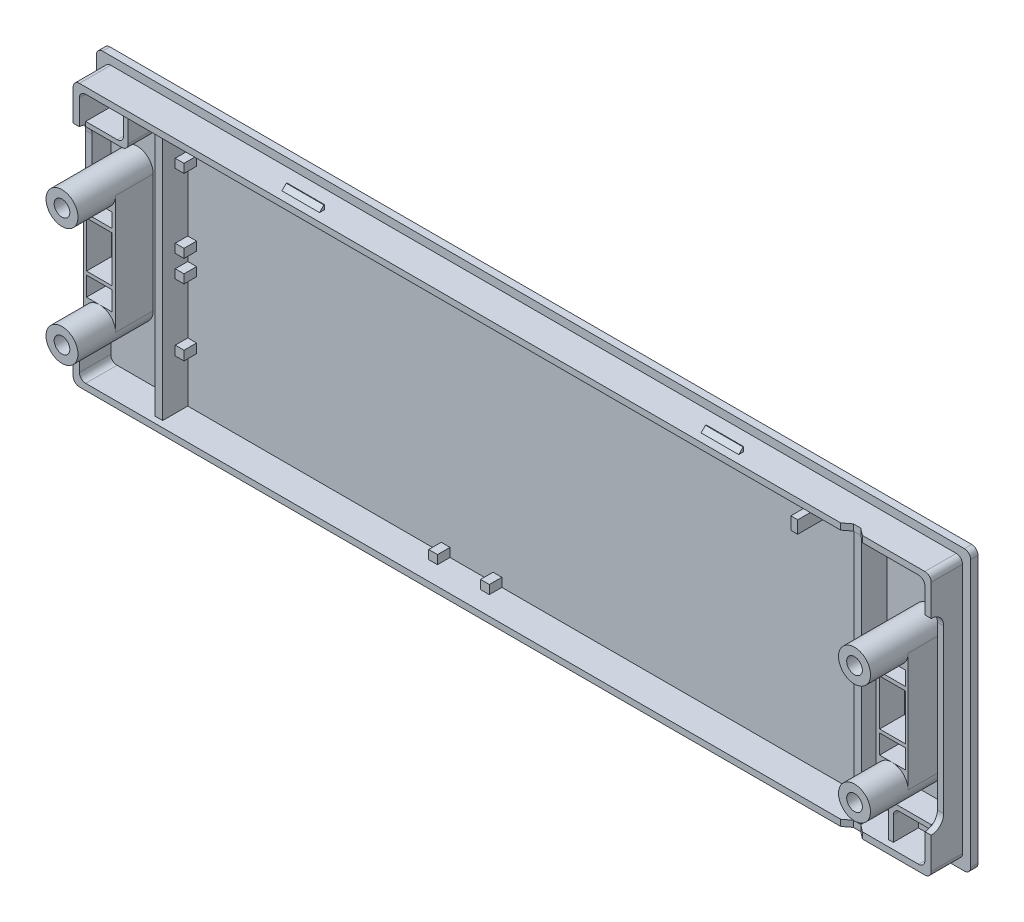
from build123d import *

# Parameters (mm, degrees)
SKETCH1_W                = 139.43
SKETCH1_H                = 44.53
BOSS_EXTRUDE1_DEPTH      = 1.17
SKETCH2_W                = 136.83
SKETCH2_H                = 41.93
SKETCH2_W_2              = 134.83
SKETCH2_H_2              = 39.93
BOSS_EXTRUDE2_DEPTH      = 5
SKETCH3_W                = 1.2
SKETCH3_H                = 39.93
BOSS_EXTRUDE3_DEPTH      = 4
SKETCH4_W                = 7.69
SKETCH4_H                = 39.93
BOSS_EXTRUDE4_DEPTH      = 11
CUT_EXTRUDE1_REACH       = 148.873
SKETCH5_W                = 7.69
SKETCH5_H                = 6.9
SKETCH6_R                = 2.55
BOSS_EXTRUDE6_DEPTH      = 2
CUT_EXTRUDE3_START       = -11
SKETCH7_W                = 7.69
SKETCH7_H                = 26.13
CUT_EXTRUDE3_DEPTH       = 11
SKETCH8_R                = 2.55
BOSS_EXTRUDE7_DEPTH      = 13
CUT_EXTRUDE4_DEPTH       = 5
SKETCH10_R               = 2.55
CUT_EXTRUDE5_DEPTH       = 1
SKETCH11_W               = 4.087353889
SKETCH11_H               = 7.313157693
CUT_EXTRUDE6_DEPTH       = 4
SKETCH12_W               = 4.087353889
SKETCH12_H               = 3.058395844
CUT_EXTRUDE7_DEPTH       = 4
SKETCH13_R               = 1.25
CUT_EXTRUDE8_DEPTH       = 10
SKETCH14_W               = 69.715
SKETCH14_H               = 44.53
CUT_EXTRUDE9_DEPTH       = 147.873260671
FILLET1_R                = 1
FILLET2_R                = 1
BOSS_EXTRUDE8_DEPTH      = 4
FILLET3_R                = 1
SKETCH16_R               = 0.868080885
CUT_EXTRUDE10_DEPTH      = 147.859272094
SKETCH17_W               = 1.4
SKETCH17_H               = 1.4
SKETCH17_H_2             = 1.487239033
BOSS_EXTRUDE10_DEPTH     = 2
SKETCH18_W               = 1.1
SKETCH18_H               = 2
BOSS_EXTRUDE11_DEPTH     = 7
CUT_EXTRUDE11_DEPTH      = 147.279002936
CUT_EXTRUDE11_DEPTH_BACK = 147.279002936
SKETCH20_W               = 6
SKETCH20_H               = 1.407940832
BOSS_EXTRUDE12_DEPTH     = 0.7
CHAMFER1_SIZE            = 1
SKETCH21_W               = 6
SKETCH21_H               = 1.1
BOSS_EXTRUDE13_DEPTH     = 0.7
CHAMFER2_SIZE            = 1
CUT_EXTRUDE12_START      = -1
SKETCH22_W               = 2
SKETCH22_H               = 29.93
CUT_EXTRUDE12_DEPTH      = 1
SKETCH23_W               = 2
SKETCH23_H               = 29.93
CUT_EXTRUDE13_DEPTH      = 1
FILLET4_R                = 2


with BuildPart() as part:
    # Sketch1 → Boss-Extrude1 (new body)
    with BuildSketch(Plane.XY):
        with Locations((69.715, 22.265)):
            Rectangle(SKETCH1_W, SKETCH1_H)
    extrude(amount=BOSS_EXTRUDE1_DEPTH)

    # Sketch2 → Boss-Extrude2 (add)
    with BuildSketch(Plane.XY.offset(1.17)):
        with Locations((69.715, 22.265)):
            Rectangle(SKETCH2_W, SKETCH2_H)
        with Locations((69.715, 22.265)):
            Rectangle(SKETCH2_W_2, SKETCH2_H_2, mode=Mode.SUBTRACT)
    extrude(amount=BOSS_EXTRUDE2_DEPTH)

    # Sketch3 → Boss-Extrude3 (add)
    with BuildSketch(Plane.XY.offset(1.17)):
        with Locations((13.98, 22.265)):
            Rectangle(SKETCH3_W, SKETCH3_H)
        with Locations((125.45, 22.265)):
            Rectangle(SKETCH3_W, SKETCH3_H)
    extrude(amount=BOSS_EXTRUDE3_DEPTH)

    # Sketch4 → Boss-Extrude4 (add)
    with BuildSketch(Plane.XY.offset(1.17)):
        with Locations((133.285, 22.265)):
            Rectangle(SKETCH4_W, SKETCH4_H)
        with Locations((6.145, 22.265)):
            Rectangle(SKETCH4_W, SKETCH4_H)
    extrude(amount=BOSS_EXTRUDE4_DEPTH)

    # Cut-Extrude1: up to this face of the body (flat: up to its plane)
    cut_extrude1_end = Plane(part.part.faces().sort_by_distance((127.745, 22.265, 1.17))[0])
    # Sketch5 → Cut-Extrude1 (cut, up to the picked face)
    with BuildSketch(Plane.XY.offset(12.17), mode=Mode.PRIVATE) as cut_extrude1_sk1:
        with Locations((133.285, 5.75)):
            Rectangle(SKETCH5_W, SKETCH5_H)
    cut_extrude1_tool1 = split(extrude(cut_extrude1_sk1.sketch, amount=-CUT_EXTRUDE1_REACH, mode=Mode.PRIVATE), bisect_by=cut_extrude1_end, keep=Keep.BOTH, mode=Mode.PRIVATE)
    # Sketch5 → Cut-Extrude1 (cut, up to the picked face)
    with BuildSketch(Plane.XY.offset(12.17), mode=Mode.PRIVATE) as cut_extrude1_sk2:
        with Locations((133.285, 38.78)):
            Rectangle(SKETCH5_W, SKETCH5_H)
    cut_extrude1_tool2 = split(extrude(cut_extrude1_sk2.sketch, amount=-CUT_EXTRUDE1_REACH, mode=Mode.PRIVATE), bisect_by=cut_extrude1_end, keep=Keep.BOTH, mode=Mode.PRIVATE)
    # Sketch5 → Cut-Extrude1 (cut, up to the picked face)
    with BuildSketch(Plane.XY.offset(12.17), mode=Mode.PRIVATE) as cut_extrude1_sk3:
        with Locations((6.145, 38.78)):
            Rectangle(SKETCH5_W, SKETCH5_H)
    cut_extrude1_tool3 = split(extrude(cut_extrude1_sk3.sketch, amount=-CUT_EXTRUDE1_REACH, mode=Mode.PRIVATE), bisect_by=cut_extrude1_end, keep=Keep.BOTH, mode=Mode.PRIVATE)
    # Sketch5 → Cut-Extrude1 (cut, up to the picked face)
    with BuildSketch(Plane.XY.offset(12.17), mode=Mode.PRIVATE) as cut_extrude1_sk4:
        with Locations((6.145, 5.75)):
            Rectangle(SKETCH5_W, SKETCH5_H)
    cut_extrude1_tool4 = split(extrude(cut_extrude1_sk4.sketch, amount=-CUT_EXTRUDE1_REACH, mode=Mode.PRIVATE), bisect_by=cut_extrude1_end, keep=Keep.BOTH, mode=Mode.PRIVATE)
    add(cut_extrude1_tool1.solids().sort_by(Axis((133.285, 5.75, 12.17), (0, 0, -1)))[0], mode=Mode.SUBTRACT)
    add(cut_extrude1_tool2.solids().sort_by(Axis((133.285, 38.78, 12.17), (0, 0, -1)))[0], mode=Mode.SUBTRACT)
    add(cut_extrude1_tool3.solids().sort_by(Axis((6.145, 38.78, 12.17), (0, 0, -1)))[0], mode=Mode.SUBTRACT)
    add(cut_extrude1_tool4.solids().sort_by(Axis((6.145, 5.75, 12.17), (0, 0, -1)))[0], mode=Mode.SUBTRACT)

    # Sketch6 → Boss-Extrude6 (add)
    with BuildSketch(Plane.XY.offset(12.17)):
        with Locations(Location((132.908867588, 12.714769601, 0), (0, 0, 180))):
            Circle(SKETCH6_R)
        with Locations(Location((132.908867588, 31.615735275, 0), (0, 0, 180))):
            Circle(SKETCH6_R)
    extrude(amount=BOSS_EXTRUDE6_DEPTH)

    # Sketch7 → Cut-Extrude3 (cut)
    with BuildSketch(Plane.XY.offset(12.17).offset(CUT_EXTRUDE3_START)):
        with Locations((133.285, 22.265)):
            Rectangle(SKETCH7_W, SKETCH7_H)
        with BuildLine():
            Line((135.458867588, 31.615735275), (135.458867588, 12.714769601))
            ThreePointArc((135.458867588, 12.714769601), (132.908867588, 15.264769601), (130.358867588, 12.714769601))
            Line((130.358867588, 12.714769601), (130.358867588, 31.615735275))
            ThreePointArc((130.358867588, 31.615735275), (132.908867588, 29.065735275), (135.458867588, 31.615735275))
        make_face(mode=Mode.SUBTRACT)
    extrude(amount=CUT_EXTRUDE3_DEPTH, mode=Mode.SUBTRACT)


with BuildPart() as cut_extrude3_piece_1:
    # of the separate pieces the step leaves, piece 1, a body of its own (cut_extrude3_pieces)
    add(part.part.solids().sort_by_distance((0, 0, 0))[0])



with BuildPart() as cut_extrude3_piece_2:
    # of the separate pieces the step leaves, piece 2, a body of its own (cut_extrude3_pieces)
    add(part.part.solids().sort_by_distance((130.358867588, 12.714769601, 14.17))[0])


with BuildPart() as cut_extrude3_piece_3:
    # of the separate pieces the step leaves, piece 3, a body of its own (cut_extrude3_pieces)
    add(part.part.solids().sort_by_distance((130.358867588, 31.615735275, 14.17))[0])


with BuildPart() as cut_extrude3_piece_1_1:
    add(cut_extrude3_piece_1.part)

    add(cut_extrude3_piece_2.part)  # Boss-Extrude7 merges Cut-Extrude3 piece 2

    add(cut_extrude3_piece_3.part)  # Boss-Extrude7 merges Cut-Extrude3 piece 3
    # Sketch8 → Boss-Extrude7 (add)
    with BuildSketch(Plane.XY.offset(14.17)):
        with Locations((132.908867588, 12.714769601)):
            Circle(SKETCH8_R)
        with Locations((132.908867588, 31.615735275)):
            Circle(SKETCH8_R)
    extrude(amount=-BOSS_EXTRUDE7_DEPTH)

    # Sketch9 → Cut-Extrude4 (cut)
    with BuildSketch(Plane.XY.offset(12.17)):
        with BuildLine():
            Line((130.358867588, 12.714769601), (130.358867588, 31.615735275))
            ThreePointArc((130.358867588, 31.615735275), (132.908867588, 29.065735275), (135.458867588, 31.615735275))
            Line((135.458867588, 31.615735275), (135.458867588, 12.714769601))
            ThreePointArc((135.458867588, 12.714769601), (132.908867588, 15.264769601), (130.358867588, 12.714769601))
        make_face()
    extrude(amount=-CUT_EXTRUDE4_DEPTH, mode=Mode.SUBTRACT)

    # Sketch10 → Cut-Extrude5 (cut)
    with BuildSketch(Plane.XY.offset(14.17)):
        with Locations((132.908867588, 12.714769601)):
            Circle(SKETCH10_R)
        with Locations((132.908867588, 31.615735275)):
            Circle(SKETCH10_R)
    extrude(amount=-CUT_EXTRUDE5_DEPTH, mode=Mode.SUBTRACT)

    # Sketch11 → Cut-Extrude6 (cut)
    with BuildSketch(Plane.XY.offset(7.17)):
        with Locations((132.95618436, 22.528670874)):
            Rectangle(SKETCH11_W, SKETCH11_H)
    extrude(amount=-CUT_EXTRUDE6_DEPTH, mode=Mode.SUBTRACT)

    # Sketch12 → Cut-Extrude7 (cut)
    with BuildSketch(Plane.XY.offset(7.17)):
        with Locations((132.95618436, 16.793967523)):
            Rectangle(SKETCH12_W, SKETCH12_H)
        Polygon((132.908867588, 29.065735275), (130.912507415, 29.065735275), (130.912507415, 26.79841395), (134.999861304, 26.79841395), (134.999861304, 29.065735275), align=None)
    extrude(amount=-CUT_EXTRUDE7_DEPTH, mode=Mode.SUBTRACT)

    # Sketch13 → Cut-Extrude8 (cut)
    with BuildSketch(Plane.XY.offset(13.17)):
        with Locations((132.908867588, 12.714769601)):
            Circle(SKETCH13_R)
        with Locations((132.908867588, 31.615735275)):
            Circle(SKETCH13_R)
    extrude(amount=-CUT_EXTRUDE8_DEPTH, mode=Mode.SUBTRACT)

    # Sketch14 → Cut-Extrude9 (cut, through all)
    with BuildSketch(Plane.XY.offset(12.17)):
        with Locations((34.8575, 22.265)):
            Rectangle(SKETCH14_W, SKETCH14_H)
    extrude(amount=-CUT_EXTRUDE9_DEPTH, mode=Mode.SUBTRACT)

    # Mirror1: Cut-Extrude3 piece 1 across plane


with BuildPart() as cut_extrude3_piece_1_2:
    add(cut_extrude3_piece_1_1.part)
    add(cut_extrude3_piece_1_1.part.mirror(Plane(origin=(69.715, 44.53, 0), x_dir=(0, 0, 1), z_dir=(1, 0, 0))))

    # Fillet1
    fillet1_edges = [cut_extrude3_piece_1_2.edges().sort_by_distance(p)[0] for p in [
        (0, 0, 0.585),
        (0, 44.53, 0.585),
        (1.3, 1.3, 3.67),
        (1.3, 43.23, 3.67),
        (139.43, 0, 0.585),
        (139.43, 44.53, 0.585),
        (138.13, 1.3, 3.67),
        (138.13, 43.23, 3.67),
    ]]
    fillet(fillet1_edges, radius=FILLET1_R)

    # Fillet2
    fillet2_edges = [cut_extrude3_piece_1_2.edges().sort_by_distance(p)[0] for p in [
        (137.13, 42.23, 3.67),
        (2.3, 2.3, 3.67),
        (2.3, 42.23, 3.67),
        (137.13, 2.3, 3.67),
    ]]
    fillet(fillet2_edges, radius=FILLET2_R)

    # Sketch15 → Boss-Extrude8 (add)
    with BuildSketch(Plane.XY.offset(1.17)):
        Polygon((137.13, 7.774122341), (130.358867588, 7.774122341), (130.358867588, 2.3), (131.09, 2.3), (131.09, 7.055815955), (137.13, 7.055815955), align=None)
        Polygon((9.071132412, 42.23), (9.071132412, 36.755877659), (2.3, 36.755877659), (2.3, 37.474184045), (8.34, 37.474184045), (8.34, 42.23), align=None)
    extrude(amount=BOSS_EXTRUDE8_DEPTH)

    # Fillet3
    fillet3_edges = [cut_extrude3_piece_1_2.edges().sort_by_distance(p)[0] for p in [
        (130.358867588, 7.774122341, 3.17),
        (131.09, 7.055815955, 3.17),
        (8.34, 37.474184045, 3.17),
        (9.071132412, 36.755877659, 3.17),
    ]]
    fillet(fillet3_edges, radius=FILLET3_R)

    # Sketch16 → Cut-Extrude10 (cut, through all)
    with BuildSketch(Plane.XY.offset(1.17)):
        with Locations((6.978717736, 38.745747541)):
            Circle(SKETCH16_R)
        with Locations((132.248298395, 5.831617087)):
            Circle(SKETCH16_R)
    extrude(amount=-CUT_EXTRUDE10_DEPTH, mode=Mode.SUBTRACT)

    # Sketch17 → Boss-Extrude10 (add)
    with BuildSketch(Plane.XY.offset(1.17)):
        with Locations((124.15, 36.83)):
            Rectangle(SKETCH17_W, SKETCH17_H)
        with Locations((124.15, 25.09)):
            Rectangle(SKETCH17_W, SKETCH17_H)
        with Locations((124.15, 20.93)):
            Rectangle(SKETCH17_W, SKETCH17_H)
        with Locations((124.15, 9.53)):
            Rectangle(SKETCH17_W, SKETCH17_H)
        with Locations((63.967264398, 3)):
            Rectangle(SKETCH17_W, SKETCH17_H)
        with Locations((55.700863818, 3)):
            Rectangle(SKETCH17_W, SKETCH17_H)
        with Locations((55.700863818, 41.53)):
            Rectangle(SKETCH17_W, SKETCH17_H)
        with Locations((63.967264398, 41.53)):
            Rectangle(SKETCH17_W, SKETCH17_H)
        with Locations((15.28, 36.83)):
            Rectangle(SKETCH17_W, SKETCH17_H)
        with Locations((15.28, 25.09)):
            Rectangle(SKETCH17_W, SKETCH17_H)
        with Locations((15.28, 21.565)):
            Rectangle(SKETCH17_W, SKETCH17_H)
        with Locations((15.28, 10.973619517)):
            Rectangle(SKETCH17_W, SKETCH17_H_2)
    extrude(amount=BOSS_EXTRUDE10_DEPTH)

    # Sketch18 → Boss-Extrude11 (add)
    with BuildSketch(Plane.XY.offset(1.17)):
        with Locations((118.3, 41.23)):
            Rectangle(SKETCH18_W, SKETCH18_H)
    extrude(amount=BOSS_EXTRUDE11_DEPTH)

    # Sketch19 → Cut-Extrude11 (cut, two sides: drawn at the far end of the back side and taken through both)
    with BuildSketch(Plane.XZ.offset(-42.23).offset(-CUT_EXTRUDE11_DEPTH_BACK)):
        Polygon((126.026481333, 5.292722726), (124.842574634, 5.292722726), (123.70133124, 6.17), (123.540219191, 6.293847323), (127.326481333, 6.293847323), align=None)
    extrude(amount=CUT_EXTRUDE11_DEPTH + CUT_EXTRUDE11_DEPTH_BACK, mode=Mode.SUBTRACT)

    # Sketch20 → Boss-Extrude12 (add)
    with BuildSketch(Plane.XZ.offset(-1.3)):
        with Locations((36.29, 4.773970416)):
            Rectangle(SKETCH20_W, SKETCH20_H)
        with Locations((103.14, 4.773970416)):
            Rectangle(SKETCH20_W, SKETCH20_H)
    extrude(amount=BOSS_EXTRUDE12_DEPTH)

    # Chamfer1
    # the kernel refuses this chamfer: 1 mm, written as the material it takes off along each edge
    with BuildSketch(Plane(origin=(97.568317012, 0.6, 5.477940832), x_dir=(0, 0.9996219169112968, 0.027495876610586494), z_dir=(1, 0, 0))) as chamfer1_piece_1_section:
        Polygon((CHAMFER1_SIZE * 0.999621916911, -CHAMFER1_SIZE * 0.0274958766106), (-CHAMFER1_SIZE * 0.0274958766106, -CHAMFER1_SIZE * 0.999621916911), (0, 0), align=None)
    chamfer1_piece_1 = extrude(amount=11.143365976, mode=Mode.PRIVATE)
    chamfer1_piece_1 = split(chamfer1_piece_1, bisect_by=Plane(origin=(103.14, 1.3, 5.118973083), z_dir=(0, -1, 0)), keep=Keep.TOP, mode=Mode.PRIVATE)
    add(chamfer1_piece_1, mode=Mode.SUBTRACT)
    with BuildSketch(Plane(origin=(30.718317012, 0.6, 5.477940832), x_dir=(0, 0.9996219169112968, 0.027495876610586494), z_dir=(1, 0, 0))) as chamfer1_piece_2_section:
        Polygon((CHAMFER1_SIZE * 0.999621916911, -CHAMFER1_SIZE * 0.0274958766106), (-CHAMFER1_SIZE * 0.0274958766106, -CHAMFER1_SIZE * 0.999621916911), (0, 0), align=None)
    chamfer1_piece_2 = extrude(amount=11.143365976, mode=Mode.PRIVATE)
    chamfer1_piece_2 = split(chamfer1_piece_2, bisect_by=Plane(origin=(36.29, 1.3, 5.118973083), z_dir=(0, -1, 0)), keep=Keep.TOP, mode=Mode.PRIVATE)
    add(chamfer1_piece_2, mode=Mode.SUBTRACT)

    # Sketch21 → Boss-Extrude13 (add)
    with BuildSketch(Plane(origin=(0, 43.23, 0), x_dir=(1, 0, 0), z_dir=(0, 1, 0))):
        with Locations((103.14, -4.62)):
            Rectangle(SKETCH21_W, SKETCH21_H)
        with Locations((36.29, -4.62)):
            Rectangle(SKETCH21_W, SKETCH21_H)
    extrude(amount=BOSS_EXTRUDE13_DEPTH)

    # Chamfer2
    # the kernel refuses this chamfer: 1 mm, written as the material it takes off along each edge
    with BuildSketch(Plane(origin=(41.861682988, 43.93, 5.17), x_dir=(0, -0.9996219169112968, 0.027495876610586414), z_dir=(-1, 0, 0))) as chamfer2_piece_1_section:
        Polygon((CHAMFER2_SIZE * 0.999621916911, -CHAMFER2_SIZE * 0.0274958766106), (-CHAMFER2_SIZE * 0.0274958766106, -CHAMFER2_SIZE * 0.999621916911), (0, 0), align=None)
    chamfer2_piece_1 = extrude(amount=11.143365976, mode=Mode.PRIVATE)
    chamfer2_piece_1 = split(chamfer2_piece_1, bisect_by=Plane(origin=(36.29, 43.23, 4.811032251), z_dir=(0, 1, 0)), keep=Keep.TOP, mode=Mode.PRIVATE)
    add(chamfer2_piece_1, mode=Mode.SUBTRACT)
    with BuildSketch(Plane(origin=(108.711682988, 43.93, 5.17), x_dir=(0, -0.9996219169112968, 0.027495876610586414), z_dir=(-1, 0, 0))) as chamfer2_piece_2_section:
        Polygon((CHAMFER2_SIZE * 0.999621916911, -CHAMFER2_SIZE * 0.0274958766106), (-CHAMFER2_SIZE * 0.0274958766106, -CHAMFER2_SIZE * 0.999621916911), (0, 0), align=None)
    chamfer2_piece_2 = extrude(amount=11.143365976, mode=Mode.PRIVATE)
    chamfer2_piece_2 = split(chamfer2_piece_2, bisect_by=Plane(origin=(103.14, 43.23, 4.811032251), z_dir=(0, 1, 0)), keep=Keep.TOP, mode=Mode.PRIVATE)
    add(chamfer2_piece_2, mode=Mode.SUBTRACT)

    # Sketch22 → Cut-Extrude12 (cut)
    with BuildSketch(Plane.ZY.offset(-1.3).offset(CUT_EXTRUDE12_START)):
        with Locations((5.17, 22.265)):
            Rectangle(SKETCH22_W, SKETCH22_H)
    extrude(amount=CUT_EXTRUDE12_DEPTH, mode=Mode.SUBTRACT)

    # Sketch23 → Cut-Extrude13 (cut)
    with BuildSketch(Plane(origin=(138.13, 0, 0), x_dir=(0, 0, -1), z_dir=(1, 0, 0))):
        with Locations((-5.17, 22.265)):
            Rectangle(SKETCH23_W, SKETCH23_H)
    extrude(amount=-CUT_EXTRUDE13_DEPTH, mode=Mode.SUBTRACT)

    # Fillet4
    # the kernel refuses this fillet: 2 mm, written as the material it adds along each edge
    with BuildSketch(Plane(origin=(2.3, 37.23, 4.17), x_dir=(0, -1, 0), z_dir=(-1, 0, 0)), Plane(origin=(138.13, 7.3, 4.17), x_dir=(0, 0, 1), z_dir=(-1, 0, 0)), Plane(origin=(138.13, 37.23, 4.17), x_dir=(0, -1, 0), z_dir=(-1, 0, 0))) as fillet4_piece_1:
        with BuildLine():
            CenterArc((FILLET4_R, FILLET4_R), FILLET4_R, 180, 90)
            Line((0, FILLET4_R), (0, 0))
            Line((0, 0), (FILLET4_R, 0))
        make_face()
    extrude(amount=1)
    with BuildSketch(Plane(origin=(2.3, 7.3, 4.17), x_dir=(0, 1, 0), z_dir=(-1, 0, 0))) as fillet4_piece_2:
        with BuildLine():
            CenterArc((FILLET4_R, -FILLET4_R), FILLET4_R, 90, 90)
            Line((0, -FILLET4_R), (0, 0))
            Line((0, 0), (FILLET4_R, 0))
        make_face()
    extrude(amount=1)


solid = cut_extrude3_piece_1_2.part
